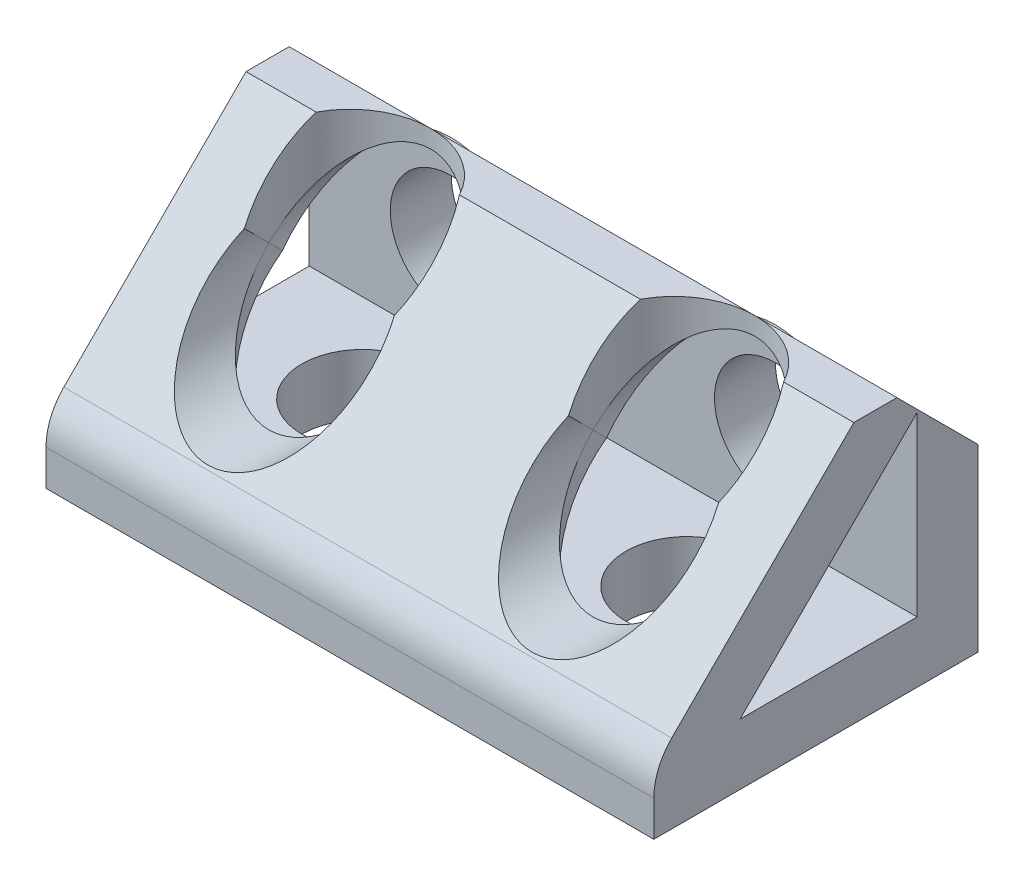
from build123d import *

# Parameters (mm, degrees)
BOSS_EXTRUDE1_START     = -20.6248
BOSS_EXTRUDE1_OUTLINE_W = 47.625
BOSS_EXTRUDE1_OUTLINE_H = 20.6248
BOSS_EXTRUDE1_DEPTH     = 25.4
BOSS_EXTRUDE1_2_DEPTH   = 4.7752
BOSS_EXTRUDE1_START_2   = 4.7752
BOSS_EXTRUDE1_3_DEPTH   = 20.6248
BOSS_EXTRUDE1_START_3   = -23.8125
BOSS_EXTRUDE1_4_DEPTH   = 47.625
SKETCH2_W               = 47.625
SKETCH2_H               = 25.4
BOSS_EXTRUDE2_DEPTH     = 4.7752
FILLET1_R               = 4.7752
CUT_EXTRUDE1_DEPTH      = 60.652834174
CHAMFER2_SIZE           = 6.35
SKETCH4_R               = 4.7625
CUT_EXTRUDE2_DEPTH      = 39.181153396
SKETCH5_R               = 4.7625
CUT_EXTRUDE3_DEPTH      = 38.556588562


with BuildPart() as part:
    # Boss-Extrude1: read off the stored shape, not the designer's step
    # Boss-Extrude1 outline → Boss-Extrude1 (new body)
    with BuildSketch(Plane.XZ.offset(-4.7752).offset(BOSS_EXTRUDE1_START)):
        with Locations((0, 15.0876)):
            Rectangle(BOSS_EXTRUDE1_OUTLINE_W, BOSS_EXTRUDE1_OUTLINE_H)
        with BuildLine():
            ThreePointArc((-18.972513521, 11.711023698), (-12.7, 19.05), (-6.427486479, 11.711023698))
            ThreePointArc((-6.427486479, 11.711023698), (-12.7, 6.35), (-18.972513521, 11.711023698))
        make_face(mode=Mode.SUBTRACT)
        with BuildLine():
            ThreePointArc((6.427486479, 11.711023698), (12.7, 19.05), (18.972513521, 11.711023698))
            ThreePointArc((18.972513521, 11.711023698), (12.7, 6.35), (6.427486479, 11.711023698))
        make_face(mode=Mode.SUBTRACT)
    extrude(amount=BOSS_EXTRUDE1_DEPTH)

    # Boss-Extrude1 2 outline → Boss-Extrude1 2 (add)
    with BuildSketch(Plane.XZ.offset(-4.7752)):
        with BuildLine():
            ThreePointArc((-18.972513521, 11.711023698), (-12.7, 6.35), (-6.427486479, 11.711023698))
            ThreePointArc((-6.427486479, 11.711023698), (-12.7, 19.05), (-18.972513521, 11.711023698))
        make_face()
        with BuildLine():
            ThreePointArc((6.427486479, 11.711023698), (12.7, 6.35), (18.972513521, 11.711023698))
            ThreePointArc((18.972513521, 11.711023698), (12.7, 19.05), (6.427486479, 11.711023698))
        make_face()
    extrude(amount=BOSS_EXTRUDE1_2_DEPTH)

    # Boss-Extrude1 3 outline → Boss-Extrude1 3 (cut)
    with BuildSketch(Plane.XY.offset(BOSS_EXTRUDE1_START_2)):
        with BuildLine():
            ThreePointArc((18.972513521, 11.711023698), (12.7, 19.05), (6.427486479, 11.711023698))
            ThreePointArc((6.427486479, 11.711023698), (12.7, 6.35), (18.972513521, 11.711023698))
        make_face()
        with BuildLine():
            ThreePointArc((-6.427486479, 11.711023698), (-12.7, 19.05), (-18.972513521, 11.711023698))
            ThreePointArc((-18.972513521, 11.711023698), (-12.7, 6.35), (-6.427486479, 11.711023698))
        make_face()
    extrude(amount=BOSS_EXTRUDE1_3_DEPTH, mode=Mode.SUBTRACT)

    # Boss-Extrude1 4 outline → Boss-Extrude1 4 (cut)
    with BuildSketch(Plane.YZ.offset(BOSS_EXTRUDE1_START_3)):
        Polygon((25.4, 25.4), (4.7752, 25.4), (25.4, 4.7752), align=None)
        Polygon((4.7752, 4.7752), (18.646847397, 4.7752), (4.7752, 18.646847397), align=None)
    extrude(amount=BOSS_EXTRUDE1_4_DEPTH, mode=Mode.SUBTRACT)

    # Sketch2 → Boss-Extrude2 (add)
    with BuildSketch(Plane(origin=(0, 0, 4.7752), x_dir=(-1, 0, 0), z_dir=(0, 0, -1))):
        with Locations((0, 12.7)):
            Rectangle(SKETCH2_W, SKETCH2_H)
    extrude(amount=BOSS_EXTRUDE2_DEPTH)

    # Fillet1
    fillet1_edges = [part.edges().sort_by_distance(p)[0] for p in [
        (0, 25.4, 4.7752),
        (0, 4.7752, 25.4),
    ]]
    fillet(fillet1_edges, radius=FILLET1_R)

    # Sketch3 → Cut-Extrude1 (cut, through all)
    with BuildSketch(Plane(origin=(23.8125, 0, 0), x_dir=(0, 0, -1), z_dir=(1, 0, 0))):
        Polygon((0, 20.447), (-11.476191114, 20.447), (-2.66042984, 31.108635465), (0, 31.108635465), align=None)
    extrude(amount=-CUT_EXTRUDE1_DEPTH, mode=Mode.SUBTRACT)

    # Chamfer2
    chamfer2_edges = [part.edges().sort_by_distance(p)[0] for p in [
        (0, 20.447, 0),
    ]]
    chamfer(chamfer2_edges, length=CHAMFER2_SIZE - 0.0001)  # a hair under: the kernel refuses the full size

    # Sketch4 → Cut-Extrude2 (cut, through all)
    with BuildSketch(Plane(origin=(0, 4.7752, 0), x_dir=(1, 0, 0), z_dir=(0, 1, 0))):
        with Locations(Location((-12.7, -11.71067, 0), (0, 0, 270))):
            Circle(SKETCH4_R)
        with Locations(Location((12.7, -11.71067, 0), (0, 0, 90))):
            Circle(SKETCH4_R)
    extrude(amount=-CUT_EXTRUDE2_DEPTH, mode=Mode.SUBTRACT)

    # Sketch5 → Cut-Extrude3 (cut, through all)
    with BuildSketch(Plane.XY.offset(4.7752)):
        with Locations((-12.7, 11.71067)):
            Circle(SKETCH5_R)
        with Locations(Location((12.7, 11.71067, 0), (0, 0, 30.070595226))):
            Circle(SKETCH5_R)
    extrude(amount=-CUT_EXTRUDE3_DEPTH, mode=Mode.SUBTRACT)


solid = part.part
